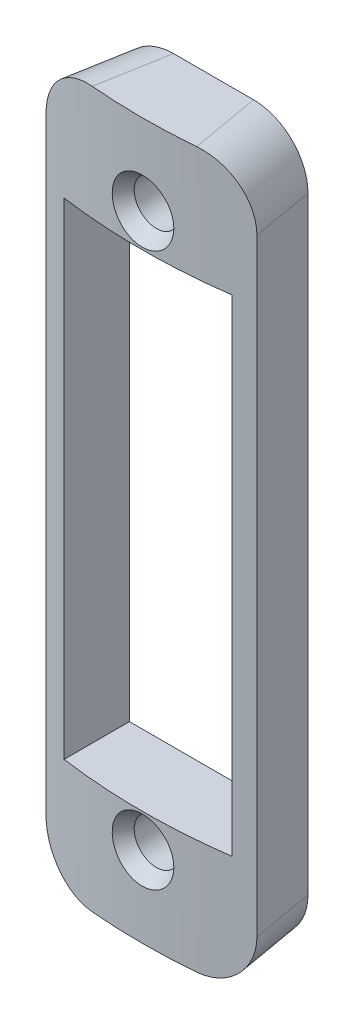
from build123d import *

# Parameters (mm, degrees)
SKETCH1_W                         = 2
SKETCH1_H                         = 40
BULK_EXTRUDE_ANGLE                = 20
CONNECTOR_PASSTHRU_DEPTH          = 41.509013499
CONNECTOR_PASSTHRU_DEPTH_BACK     = 41.509013499
SKETCH2_R                         = 1.25
SKETCH2_W                         = 9.4
SKETCH2_H                         = 27.2
REAR_FLATTENING_REACH             = 42.509
SKETCH3_W                         = 11.10393272
SKETCH3_H                         = 40
SKETCH3_R                         = 1.25
SKETCH3_W_2                       = 9.4
SKETCH3_H_2                       = 27.2
REAR_FLATTENING_DIRECTION_2_DEPTH = 1.5
SKETCH4_W                         = 5.405389312
SKETCH4_H                         = 40
CUT_EXTRUDE2_DEPTH                = 42.783584431
SKETCH5_W                         = 5.359461023
SKETCH5_H                         = 40
CUT_EXTRUDE3_DEPTH                = 42.783584431
FILLET1_R                         = 3


with BuildPart() as part:
    # Sketch1 → BULK EXTRUDE (revolve, symmetric)
    with BuildSketch(Plane(origin=(0, 0, 0), x_dir=(0, 0, -1), z_dir=(1, 0, 0))) as bulk_extrude_sk:
        with Locations((1, 20)):
            Rectangle(SKETCH1_W, SKETCH1_H)
    revolve(axis=Axis((0, 0, -33.9725), (0, 1, 0)), revolution_arc=BULK_EXTRUDE_ANGLE / 2)
    revolve(bulk_extrude_sk.sketch, axis=Axis((0, 0, -33.9725), (0, -1, 0)), revolution_arc=BULK_EXTRUDE_ANGLE / 2)

    # Sketch2 → CONNECTOR PASSTHRU (cut, two sides: drawn at the far end of the back side and taken through both)
    with BuildSketch(Plane.XY.offset(-CONNECTOR_PASSTHRU_DEPTH_BACK)):
        with Locations((0, 4.52)):
            Circle(SKETCH2_R)
        with Locations((0, 35.48)):
            Circle(SKETCH2_R)
        with Locations((0, 20)):
            Rectangle(SKETCH2_W, SKETCH2_H)
    extrude(amount=CONNECTOR_PASSTHRU_DEPTH + CONNECTOR_PASSTHRU_DEPTH_BACK, mode=Mode.SUBTRACT)

    # Sketch3 → REAR FLATTENING (add, up to next)
    with BuildSketch(Plane.XY.offset(-2.485734117), mode=Mode.PRIVATE) as rear_flattening_sk1:
        with Locations((0, 20)):
            Rectangle(SKETCH3_W, SKETCH3_H)
        with Locations((0, 4.52)):
            Circle(SKETCH3_R, mode=Mode.SUBTRACT)
        with Locations((0, 35.48)):
            Circle(SKETCH3_R, mode=Mode.SUBTRACT)
        with Locations((0, 20)):
            Rectangle(SKETCH3_W_2, SKETCH3_H_2, mode=Mode.SUBTRACT)
    rear_flattening_tool1 = extrude(rear_flattening_sk1.sketch, amount=REAR_FLATTENING_REACH, mode=Mode.PRIVATE) - part.part
    add(rear_flattening_tool1.solids().sort_by_distance((0, 0.415126, -2.485734))[0])

    # Sketch3 → REAR FLATTENING direction 2 (add)
    with BuildSketch(Plane.XY.offset(-2.485734117)):
        with Locations((0, 20)):
            Rectangle(SKETCH3_W, SKETCH3_H)
        with Locations((0, 4.52)):
            Circle(SKETCH3_R, mode=Mode.SUBTRACT)
        with Locations((0, 35.48)):
            Circle(SKETCH3_R, mode=Mode.SUBTRACT)
        with Locations((0, 20)):
            Rectangle(SKETCH3_W_2, SKETCH3_H_2, mode=Mode.SUBTRACT)
    extrude(amount=-REAR_FLATTENING_DIRECTION_2_DEPTH)

    # Sketch4 → Cut-Extrude2 (cut, through all)
    with BuildSketch(Plane(origin=(5.80963966, 0, -1.02439622), x_dir=(-0.17364817766693075, 0, -0.9848077530122081), z_dir=(0.9848077530122081, 0, -0.17364817766693075))):
        with Locations((2.186576045, 20)):
            Rectangle(SKETCH4_W, SKETCH4_H)
    extrude(amount=CUT_EXTRUDE2_DEPTH, mode=Mode.SUBTRACT)

    # Sketch5 → Cut-Extrude3 (cut, through all)
    with BuildSketch(Plane(origin=(-5.80963966, 0, -1.02439622), x_dir=(-0.17364817766693072, 0, 0.9848077530122081), z_dir=(-0.9848077530122081, 0, -0.17364817766693072))):
        with Locations((-2.163611901, 20)):
            Rectangle(SKETCH5_W, SKETCH5_H)
    extrude(amount=CUT_EXTRUDE3_DEPTH, mode=Mode.SUBTRACT)

    # Fillet1
    fillet1_edges = [part.edges().sort_by_distance(p)[0] for p in [
        (5.593369303, 40, -2.250926364),
        (5.593369303, 0, -2.250926364),
        (-5.593369303, 0, -2.250926364),
        (-5.593369303, 40, -2.250926364),
    ]]
    fillet(fillet1_edges, radius=FILLET1_R)

    # Sketch6 → Cut-Revolve1 (revolve, cut)
    with BuildSketch(Plane.ZY):
        Polygon((0, 4.52), (0, 6.27), (-1, 5.645), (-1, 4.52), align=None)
    cut_revolve1 = revolve(axis=Axis((0, 4.52, -3.985734117), (0, 0, 1)), mode=Mode.SUBTRACT)

    # Mirror1: Cut-Revolve1 across plane
    add(cut_revolve1.mirror(Plane.ZX.offset(20)), mode=Mode.SUBTRACT)


solid = part.part
